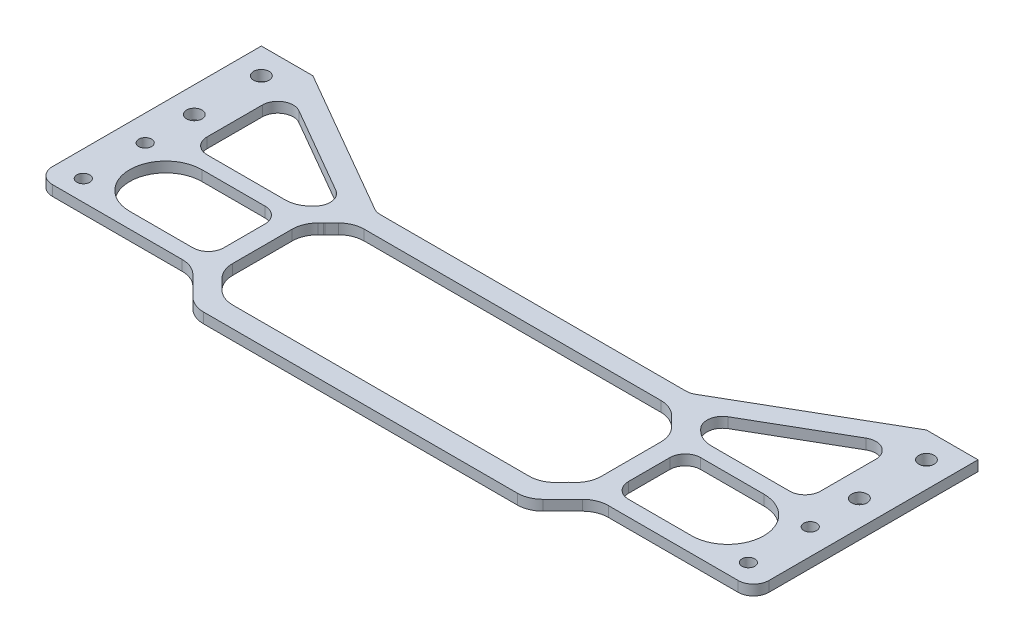
from build123d import *

# Parameters (mm, degrees)
EXTRUDE_1_DEPTH          = 2
HOLE_WIZARD_1_D          = 2.5
CUT_EXTRUDE_1_DEPTH      = 71.244216844
EXTRUDE_2_DEPTH          = 2
CUT_EXTRUDE_2_DEPTH      = 71.244216844
CUT_EXTRUDE_2_DEPTH_BACK = 71.244216844
EXTRUDE_3_DEPTH          = 2
CUT_EXTRUDE_3_DEPTH      = 72.517917335
CUT_EXTRUDE_3_DEPTH_BACK = 72.517917335
EXTRUDE_4_DEPTH          = 2
HOLE_WIZARD_2_D          = 3


with BuildPart() as part:
    # 草图1 → 凸台-拉伸1 (new body)
    with BuildSketch(Plane(origin=(0, 0, 0), x_dir=(1, 0, 0), z_dir=(0, 1, 0))):
        with BuildLine():
            Line((66.5, 10), (-66.5, 10))
            ThreePointArc((-66.5, 10), (-68.621320344, 9.121320344), (-69.5, 7))
            Line((-69.5, 7), (-69.5, -7))
            ThreePointArc((-69.5, -7), (-68.621320344, -9.121320344), (-66.5, -10))
            Line((-66.5, -10), (66.5, -10))
            ThreePointArc((66.5, -10), (68.621320344, -9.121320344), (69.5, -7))
            Line((69.5, -7), (69.5, 7))
            ThreePointArc((69.5, 7), (68.621320344, 9.121320344), (66.5, 10))
        make_face()
    extrude(amount=EXTRUDE_1_DEPTH)

    # 孔1 (through all)
    with Locations(Plane(origin=(0, 2, 0), x_dir=(1, 0, 0), z_dir=(0, 1, 0))):
        with Locations((-64.5, 6), (-64.5, -6), (64.5, -6), (64.5, 6)):
            Hole(HOLE_WIZARD_1_D / 2)

    # 草图5 → 切除-拉伸1 (cut, through all)
    with BuildSketch(Plane(origin=(0, 2, 0), x_dir=(1, 0, 0), z_dir=(0, 1, 0))):
        with BuildLine():
            Line((-54.5, 7), (54.5, 7))
            ThreePointArc((54.5, 7), (61.5, 0), (54.5, -7))
            Line((54.5, -7), (-54.5, -7))
            ThreePointArc((-54.5, -7), (-61.5, 0), (-54.5, 7))
        make_face()
    extrude(amount=-CUT_EXTRUDE_1_DEPTH, mode=Mode.SUBTRACT)

    # 草图6 → 凸台-拉伸2 (add)
    with BuildSketch(Plane.XZ):
        with BuildLine():
            Line((-39.25, -10), (39.25, -10))
            Line((39.25, -10), (46.785993788, -7))
            Line((46.785993788, -7), (42.25, -7))
            ThreePointArc((42.25, -7), (40.128679656, -6.121320344), (39.25, -4))
            Line((39.25, -4), (39.25, 4))
            ThreePointArc((39.25, 4), (40.128679656, 6.121320344), (42.25, 7))
            Line((42.25, 7), (46.785993788, 7))
            Line((46.785993788, 7), (39.25, 10))
            Line((39.25, 10), (-39.25, 10))
            Line((-39.25, 10), (-46.785993788, 7))
            Line((-46.785993788, 7), (-42.25, 7))
            ThreePointArc((-42.25, 7), (-40.128679656, 6.121320344), (-39.25, 4))
            Line((-39.25, 4), (-39.25, -4))
            ThreePointArc((-39.25, -4), (-40.128679656, -6.121320344), (-42.25, -7))
            Line((-42.25, -7), (-46.49444439, -7))
            Line((-46.49444439, -7), (-39.25, -10))
        make_face()
    extrude(amount=-EXTRUDE_2_DEPTH)

    # 草图7 → 切除-拉伸2 (cut, two sides: drawn at the far end of the back side and taken through both)
    with BuildSketch(Plane.XZ.offset(-CUT_EXTRUDE_2_DEPTH_BACK)):
        with BuildLine():
            Line((34.25, -1.5), (-34.25, -1.5))
            ThreePointArc((-34.25, -1.5), (-35.75, 0), (-34.25, 1.5))
            Line((-34.25, 1.5), (34.25, 1.5))
            ThreePointArc((34.25, 1.5), (35.75, 0), (34.25, -1.5))
        make_face()
        with BuildLine():
            Line((34.25, 4), (-34.25, 4))
            ThreePointArc((-34.25, 4), (-35.75, 5.5), (-34.25, 7))
            Line((-34.25, 7), (34.25, 7))
            ThreePointArc((34.25, 7), (35.75, 5.5), (34.25, 4))
        make_face()
        with BuildLine():
            Line((34.25, -7), (-34.25, -7))
            ThreePointArc((-34.25, -7), (-35.75, -5.5), (-34.25, -4))
            Line((-34.25, -4), (34.25, -4))
            ThreePointArc((34.25, -4), (35.75, -5.5), (34.25, -7))
        make_face()
    extrude(amount=CUT_EXTRUDE_2_DEPTH + CUT_EXTRUDE_2_DEPTH_BACK, mode=Mode.SUBTRACT)

    # 草图9 → 凸台-拉伸3 (add)
    with BuildSketch(Plane(origin=(0, 0, 0), x_dir=(-1, 0, 0), z_dir=(0, -1, 0))):
        with BuildLine():
            ThreePointArc((37.785533906, -11.464466094), (39.40765065, -10.380602337), (41.321067812, -10))
            Line((41.321067812, -10), (33.593145751, -10))
            Line((33.593145751, -10), (32.307611845, -11.285533906))
            ThreePointArc((32.307611845, -11.285533906), (30.6854951, -12.369397663), (28.772077939, -12.75))
            Line((28.772077939, -12.75), (-28.772077939, -12.75))
            ThreePointArc((-28.772077939, -12.75), (-30.6854951, -12.369397663), (-32.307611845, -11.285533906))
            Line((-32.307611845, -11.285533906), (-33.593145751, -10))
            Line((-33.593145751, -10), (-41.321067812, -10))
            ThreePointArc((-41.321067812, -10), (-39.40765065, -10.380602337), (-37.785533906, -11.464466094))
            Line((-37.785533906, -11.464466094), (-33.964466094, -15.285533906))
            ThreePointArc((-33.964466094, -15.285533906), (-32.34234935, -16.369397663), (-30.428932188, -16.75))
            Line((-30.428932188, -16.75), (30.428932188, -16.75))
            ThreePointArc((30.428932188, -16.75), (32.34234935, -16.369397663), (33.964466094, -15.285533906))
            Line((33.964466094, -15.285533906), (37.785533906, -11.464466094))
        make_face()
        with BuildLine():
            Line((32.307611845, 11.285533906), (33.593145751, 10))
            Line((33.593145751, 10), (41.321067812, 10))
            ThreePointArc((41.321067812, 10), (39.40765065, 10.380602337), (37.785533906, 11.464466094))
            Line((37.785533906, 11.464466094), (33.964466094, 15.285533906))
            ThreePointArc((33.964466094, 15.285533906), (32.34234935, 16.369397663), (30.428932188, 16.75))
            Line((30.428932188, 16.75), (-30.428932188, 16.75))
            ThreePointArc((-30.428932188, 16.75), (-32.34234935, 16.369397663), (-33.964466094, 15.285533906))
            Line((-33.964466094, 15.285533906), (-37.785533906, 11.464466094))
            ThreePointArc((-37.785533906, 11.464466094), (-39.40765065, 10.380602337), (-41.321067812, 10))
            Line((-41.321067812, 10), (-33.593145751, 10))
            Line((-33.593145751, 10), (-32.307611845, 11.285533906))
            ThreePointArc((-32.307611845, 11.285533906), (-30.6854951, 12.369397663), (-28.772077939, 12.75))
            Line((-28.772077939, 12.75), (28.772077939, 12.75))
            ThreePointArc((28.772077939, 12.75), (30.6854951, 12.369397663), (32.307611845, 11.285533906))
        make_face()
    extrude(amount=-EXTRUDE_3_DEPTH)

    # 草图10 → 切除-拉伸3 (cut, two sides: drawn at the far end of the back side and taken through both)
    with BuildSketch(Plane(origin=(0, 2, 0), x_dir=(1, 0, 0), z_dir=(0, 1, 0)).offset(-CUT_EXTRUDE_3_DEPTH_BACK)):
        with BuildLine():
            Line((34.285533906, -9.307611845), (34.098025299, -9.495120452))
            ThreePointArc((34.098025299, -9.495120452), (32.487874075, -10.574009752), (30.588407989, -10.959519378))
            Line((30.588407989, -10.959519378), (-30.221374051, -11.274720124))
            ThreePointArc((-30.221374051, -11.274720124), (-32.148729436, -10.899128383), (-33.782824553, -9.810321198))
            Line((-33.782824553, -9.810321198), (-34.285533906, -9.307611845))
            ThreePointArc((-34.285533906, -9.307611845), (-35.369397663, -7.6854951), (-35.75, -5.772077939))
            Line((-35.75, -5.772077939), (-35.75, 5.772077939))
            ThreePointArc((-35.75, 5.772077939), (-35.369397663, 7.6854951), (-34.285533906, 9.307611845))
            Line((-34.285533906, 9.307611845), (-33.772077939, 9.821067812))
            ThreePointArc((-33.772077939, 9.821067812), (-32.149961195, 10.904931568), (-30.236544033, 11.285533906))
            Line((-30.236544033, 11.285533906), (30.236544033, 11.285533906))
            ThreePointArc((30.236544033, 11.285533906), (32.149961195, 10.904931568), (33.772077939, 9.821067812))
            Line((33.772077939, 9.821067812), (34.285533906, 9.307611845))
            ThreePointArc((34.285533906, 9.307611845), (35.369397663, 7.6854951), (35.75, 5.772077939))
            Line((35.75, 5.772077939), (35.75, -5.772077939))
            ThreePointArc((35.75, -5.772077939), (35.369397663, -7.6854951), (34.285533906, -9.307611845))
        make_face()
    extrude(amount=CUT_EXTRUDE_3_DEPTH + CUT_EXTRUDE_3_DEPTH_BACK, mode=Mode.SUBTRACT)

    # 草图11 → 凸台-拉伸4 (add)
    with BuildSketch(Plane.XZ):
        with BuildLine():
            Line((-69.5, -7), (-69.5, -33.534188827))
            Line((-69.5, -33.534188827), (-59.5, -33.534188827))
            Line((-59.5, -33.534188827), (-31.125084611, -17.151923789))
            ThreePointArc((-31.125084611, -17.151923789), (-30.401541746, -16.852222521), (-29.625084611, -16.75))
            Line((-29.625084611, -16.75), (-21.789130896, -16.75))
            Line((-21.789130896, -16.75), (-32.229816093, -13.630777579))
            Line((-32.229816093, -13.630777579), (-39.940851874, -9.309148126))
            Line((-39.940851874, -9.309148126), (-37.434698294, -11.815301706))
            ThreePointArc((-37.434698294, -11.815301706), (-36.581684053, -14.328200626), (-38.056018637, -16.534698261))
            Line((-38.056018637, -16.534698261), (-55, -26.317310462))
            ThreePointArc((-55, -26.317310462), (-58, -26.317310462), (-59.5, -23.719234251))
            Line((-59.5, -23.719234251), (-59.5, -13))
            ThreePointArc((-59.5, -13), (-58.621320344, -10.878679656), (-56.5, -10))
            Line((-56.5, -10), (-53.184301675, -10))
            Line((-53.184301675, -10), (-53.184301675, -7.987994339))
            Line((-53.184301675, -7.987994339), (-66.362001322, -7.987994339))
            Line((-66.362001322, -7.987994339), (-69.5, -7))
        make_face()
        with BuildLine():
            Line((21.789130896, -16.75), (29.625084611, -16.75))
            ThreePointArc((29.625084611, -16.75), (30.401541746, -16.852222521), (31.125084611, -17.151923789))
            Line((31.125084611, -17.151923789), (59.5, -33.534188827))
            Line((59.5, -33.534188827), (69.5, -33.534188827))
            Line((69.5, -33.534188827), (69.5, -7))
            Line((69.5, -7), (66.362001322, -7.987994339))
            Line((66.362001322, -7.987994339), (53.184301675, -7.987994339))
            Line((53.184301675, -7.987994339), (53.184301675, -10))
            Line((53.184301675, -10), (56.5, -10))
            ThreePointArc((56.5, -10), (58.621320344, -10.878679656), (59.5, -13))
            Line((59.5, -13), (59.5, -23.719234251))
            ThreePointArc((59.5, -23.719234251), (58, -26.317310462), (55, -26.317310462))
            Line((55, -26.317310462), (38.056018637, -16.534698261))
            ThreePointArc((38.056018637, -16.534698261), (36.581684053, -14.328200626), (37.434698294, -11.815301706))
            Line((37.434698294, -11.815301706), (39.940851874, -9.309148126))
            Line((39.940851874, -9.309148126), (32.229816093, -13.630777579))
            Line((32.229816093, -13.630777579), (21.789130896, -16.75))
        make_face()
    extrude(amount=-EXTRUDE_4_DEPTH)

    # 孔2 (through all)
    with Locations(Plane(origin=(0, 0, 0), x_dir=(-1, 0, 0), z_dir=(0, -1, 0))):
        with Locations((64.5, 15.534188827), (64.5, 28.534188827), (-64.5, 15.534188827), (-64.5, 28.534188827)):
            Hole(HOLE_WIZARD_2_D / 2)


solid = part.part
